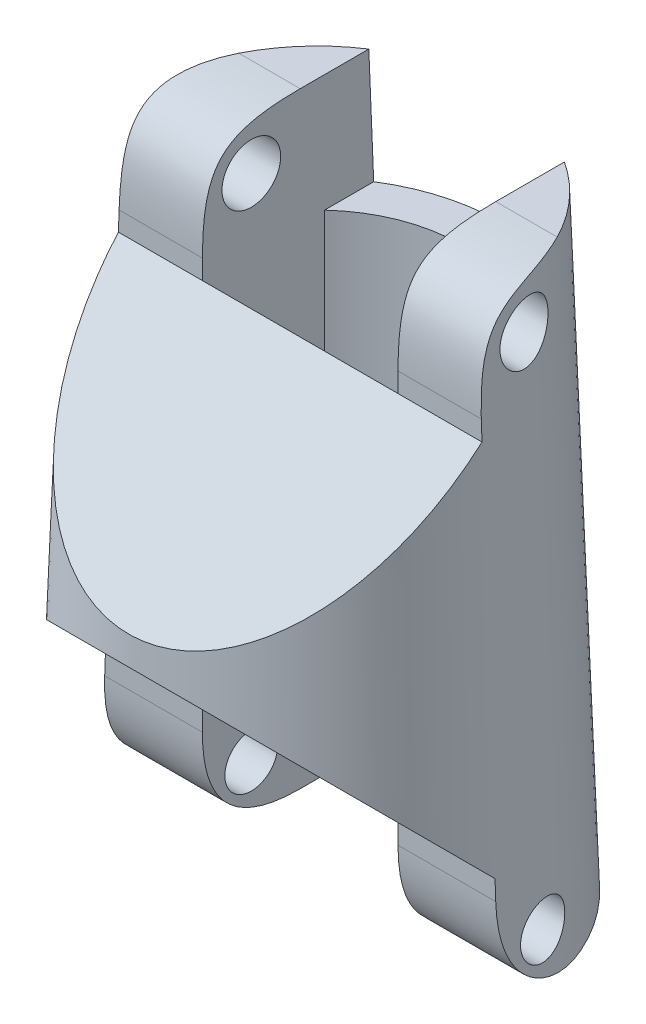
from build123d import *

# Parameters (mm, degrees)
SKETCH1_R                     = 10
BOSS_EXTRUDE1_DEPTH           = 25
BOSS_EXTRUDE1_TAPER           = 2
BOSS_EXTRUDE1_OTHER_WAY_DEPTH = 6
BOSS_EXTRUDE1_OTHER_WAY_TAPER = -2
CUT_EXTRUDE1_DEPTH            = 29.86985947
CUT_EXTRUDE1_DEPTH_BACK       = 29.86985947
SKETCH3_W                     = 10
SKETCH3_H                     = 6
CUT_EXTRUDE2_DEPTH            = 25
CUT_EXTRUDE3_DEPTH            = 31.99296746
CUT_EXTRUDE3_DEPTH_BACK       = 31.99296746
SKETCH4_R                     = 1.5
FILLET2_SIZE                  = 5
CUT_EXTRUDE5_DEPTH            = 29.869859627
CUT_EXTRUDE5_DEPTH_BACK       = 29.869859627
SKETCH8_W                     = 10
SKETCH8_H                     = 6
CUT_EXTRUDE6_DEPTH            = 30.190018507
CUT_EXTRUDE7_DEPTH            = 29.796430368
CUT_EXTRUDE8_DEPTH            = 31.924580015
CUT_EXTRUDE8_DEPTH_BACK       = 31.924580015
SKETCH9_R                     = 1.351518808
FILLET3_SIZE                  = 5


with BuildPart() as part:
    # Sketch1 → Boss-Extrude1 (new body)
    with BuildSketch(Plane(origin=(0, 0, 0), x_dir=(1, 0, 0), z_dir=(0, 1, 0))):
        Circle(SKETCH1_R)
    extrude(amount=BOSS_EXTRUDE1_DEPTH, taper=BOSS_EXTRUDE1_TAPER)

    # Sketch1 → Boss-Extrude1 other way (add)
    with BuildSketch(Plane(origin=(0, 0, 0), x_dir=(1, 0, 0), z_dir=(0, 1, 0))):
        Circle(SKETCH1_R)
    extrude(amount=-BOSS_EXTRUDE1_OTHER_WAY_DEPTH, taper=BOSS_EXTRUDE1_OTHER_WAY_TAPER)

    # Sketch2 → Cut-Extrude1 (cut, two sides: drawn at the far end of the back side and taken through both)
    with BuildSketch(Plane(origin=(0, 0, 0), x_dir=(0, 0, -1), z_dir=(1, 0, 0)).offset(-CUT_EXTRUDE1_DEPTH_BACK)):
        Polygon((-0.873019237, 25), (-0.873019237, 19), (-12.898136563, 6.974882674), (-12.898136563, 25), align=None)
    extrude(amount=CUT_EXTRUDE1_DEPTH + CUT_EXTRUDE1_DEPTH_BACK, mode=Mode.SUBTRACT)

    # Sketch3 → Cut-Extrude2 (cut)
    with BuildSketch(Plane.XY.offset(0.873019237)):
        with Locations((0, 22)):
            Rectangle(SKETCH3_W, SKETCH3_H)
    extrude(amount=-CUT_EXTRUDE2_DEPTH, mode=Mode.SUBTRACT)

    # Sketch4 → Cut-Extrude3 (cut, two sides: drawn at the far end of the back side and taken through both)
    with BuildSketch(Plane(origin=(-5, 0, 0), x_dir=(0, 0, -1), z_dir=(1, 0, 0)).offset(-CUT_EXTRUDE3_DEPTH_BACK)):
        with Locations(Location((1.626980763, 22.5, 0), (0, 0, 90))):
            Circle(SKETCH4_R)
    extrude(amount=CUT_EXTRUDE3_DEPTH + CUT_EXTRUDE3_DEPTH_BACK, mode=Mode.SUBTRACT)

    # Fillet2
    # a fillet whose section is not a circle: 5 mm, written as the material it takes off along each edge
    with BuildSketch(Plane(origin=(-7.5, 25, 0.873019237), x_dir=(0, -1, 0), z_dir=(1, 0, 0))) as fillet2_piece_1:
        with BuildLine():
            Bezier((FILLET2_SIZE, 0), (0, 0), (0, FILLET2_SIZE), weights=[1, 1.5, 1])
            Line((0, FILLET2_SIZE), (0, 0))
            Line((0, 0), (FILLET2_SIZE, 0))
        make_face()
    extrude(amount=29.085131549, mode=Mode.SUBTRACT)
    with BuildSketch(Plane(origin=(-21.585131549, 25, 0.873019237), x_dir=(0, 0, -1), z_dir=(1, 0, 0))) as fillet2_piece_2:
        with BuildLine():
            Bezier((FILLET2_SIZE, 0), (0, 0), (0, -FILLET2_SIZE), weights=[1, 1.5, 1])
            Line((0, -FILLET2_SIZE), (0, 0))
            Line((0, 0), (FILLET2_SIZE, 0))
        make_face()
    extrude(amount=29.085131549, mode=Mode.SUBTRACT)

    # Sketch7 → Cut-Extrude5 (cut, two sides: drawn at the far end of the back side and taken through both)
    with BuildSketch(Plane(origin=(0, 0, 0), x_dir=(0, 0, -1), z_dir=(1, 0, 0)).offset(-CUT_EXTRUDE5_DEPTH_BACK)):
        Polygon((-0.873019237, -6), (-0.873019237, 0), (-11.31781305, 10.444793812), (-11.31781305, -6), align=None)
    extrude(amount=CUT_EXTRUDE5_DEPTH + CUT_EXTRUDE5_DEPTH_BACK, mode=Mode.SUBTRACT)

    # Sketch8 → Cut-Extrude6 (cut, through all)
    with BuildSketch(Plane.XY.offset(0.873019237)):
        with Locations((0, -3)):
            Rectangle(SKETCH8_W, SKETCH8_H)
    extrude(amount=-CUT_EXTRUDE6_DEPTH, mode=Mode.SUBTRACT)

    # Sketch6 → Cut-Extrude7 (cut, through all)
    with BuildSketch(Plane(origin=(0, 19, 0), x_dir=(1, 0, 0), z_dir=(0, 1, 0))):
        with BuildLine():
            Line((5, 5.368827729), (5, -0.873019237))
            Line((5, -0.873019237), (-5, -0.873019237))
            Line((-5, -0.873019237), (-5, 5.368827729))
            ThreePointArc((-5, 5.368827729), (0, 7.33650538), (5, 5.368827729))
        make_face()
    extrude(amount=-CUT_EXTRUDE7_DEPTH, mode=Mode.SUBTRACT)

    # Sketch9 → Cut-Extrude8 (cut, two sides: drawn at the far end of the back side and taken through both)
    with BuildSketch(Plane(origin=(-5, 0, 0), x_dir=(0, 0, -1), z_dir=(1, 0, 0)).offset(-CUT_EXTRUDE8_DEPTH_BACK)):
        with Locations(Location((1.626980763, -3.5, 0), (0, 0, 90))):
            Circle(SKETCH9_R)
    extrude(amount=CUT_EXTRUDE8_DEPTH + CUT_EXTRUDE8_DEPTH_BACK, mode=Mode.SUBTRACT)

    # Fillet3
    # a fillet whose section is not a circle: 5 mm, written as the material it takes off along each edge
    with BuildSketch(Plane(origin=(22.672130078, -6, 0.873019237), x_dir=(0, 0, -1), z_dir=(-1, 0, 0))) as fillet3_piece_1:
        with BuildLine():
            Bezier((FILLET3_SIZE, 0), (0, 0), (0, -FILLET3_SIZE), weights=[1, 1, 1])
            Line((0, -FILLET3_SIZE), (0, 0))
            Line((0, 0), (FILLET3_SIZE, 0))
        make_face()
    extrude(amount=30.172130078, mode=Mode.SUBTRACT)
    with BuildSketch(Plane(origin=(7.5, -6, 0.873019237), x_dir=(0, 1, 0), z_dir=(-1, 0, 0))) as fillet3_piece_2:
        with BuildLine():
            Bezier((FILLET3_SIZE, 0), (0, 0), (0, FILLET3_SIZE), weights=[1, 1, 1])
            Line((0, FILLET3_SIZE), (0, 0))
            Line((0, 0), (FILLET3_SIZE, 0))
        make_face()
    extrude(amount=30.172130078, mode=Mode.SUBTRACT)


solid = part.part
